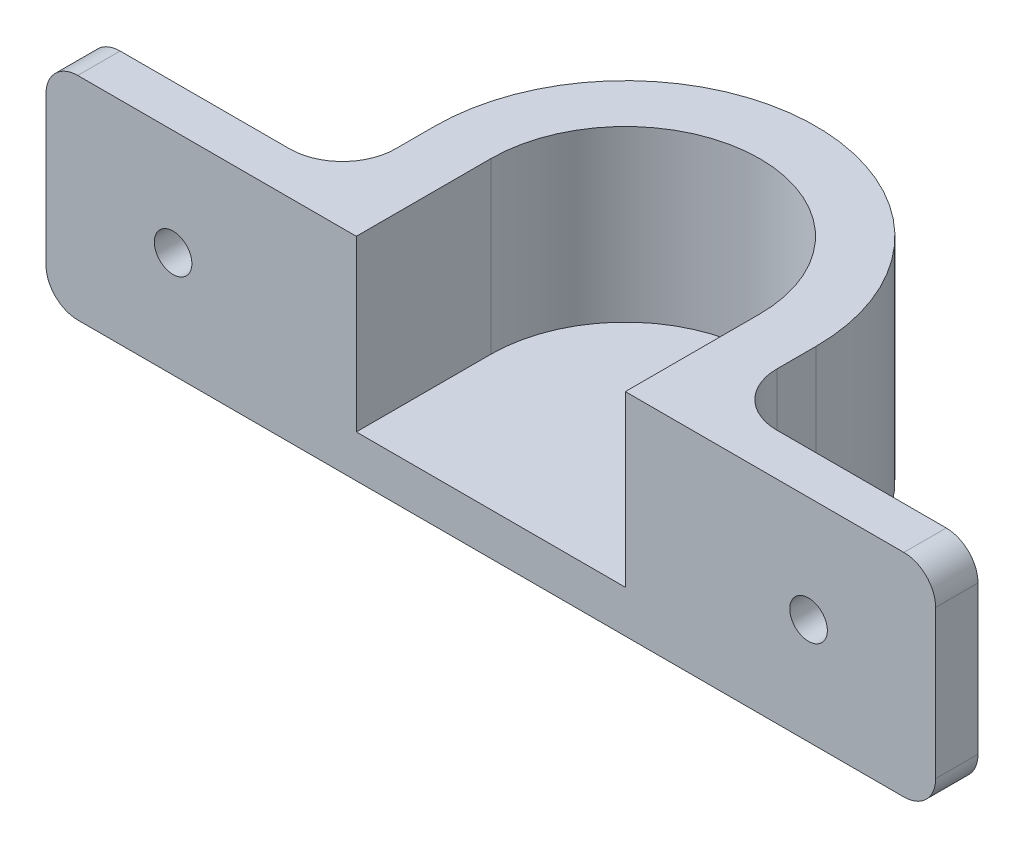
from build123d import *

# Parameters (mm, degrees)
BOSS_EXTRUDE1_DEPTH = 20
SKETCH2_R           = 1.775
CUT_EXTRUDE1_DEPTH  = 91.381911907
FILLET1_R           = 3
FILLET2_R           = 5
BOSS_EXTRUDE2_DEPTH = 4


with BuildPart() as part:
    # Sketch1 → Boss-Extrude1 (new body)
    with BuildSketch(Plane(origin=(0, 0, 0), x_dir=(1, 0, 0), z_dir=(0, 1, 0))):
        with BuildLine():
            Line((0, 0), (0, 4))
            Line((0, 4), (24, 4))
            Line((24, 4), (24, 12.7))
            ThreePointArc((24, 12.7), (42, 30.7), (60, 12.7))
            Line((60, 12.7), (60, 4))
            Line((60, 4), (84, 4))
            Line((84, 4), (84, 0))
            Line((84, 0), (54.7, 0))
            Line((54.7, 0), (54.7, 12.7))
            ThreePointArc((54.7, 12.7), (42, 25.4), (29.3, 12.7))
            Line((29.3, 12.7), (29.3, 0))
            Line((29.3, 0), (0, 0))
        make_face()
    extrude(amount=BOSS_EXTRUDE1_DEPTH)

    # Sketch2 → Cut-Extrude1 (cut, through all)
    with BuildSketch(Plane(origin=(0, 0, -4), x_dir=(-1, 0, 0), z_dir=(0, 0, -1))):
        with Locations((-72, 10)):
            Circle(SKETCH2_R)
        with Locations((-12, 10)):
            Circle(SKETCH2_R)
    extrude(amount=-CUT_EXTRUDE1_DEPTH, mode=Mode.SUBTRACT)

    # Fillet1
    fillet1_edges = [part.edges().sort_by_distance(p)[0] for p in [
        (0, 0, -2),
        (0, 20, -2),
        (84, 0, -2),
        (84, 20, -2),
    ]]
    fillet(fillet1_edges, radius=FILLET1_R)

    # Fillet2
    fillet2_edges = [part.edges().sort_by_distance(p)[0] for p in [
        (60, 10, -4),
        (24, 10, -4),
    ]]
    fillet(fillet2_edges, radius=FILLET2_R)

    # Sketch4 → Boss-Extrude2 (add)
    with BuildSketch(Plane.XZ):
        with BuildLine():
            Line((29.3, 0), (54.7, 0))
            Line((54.7, 0), (54.7, -12.7))
            ThreePointArc((54.7, -12.7), (42, -25.4), (29.3, -12.7))
            Line((29.3, -12.7), (29.3, 0))
        make_face()
    extrude(amount=-BOSS_EXTRUDE2_DEPTH)


solid = part.part
